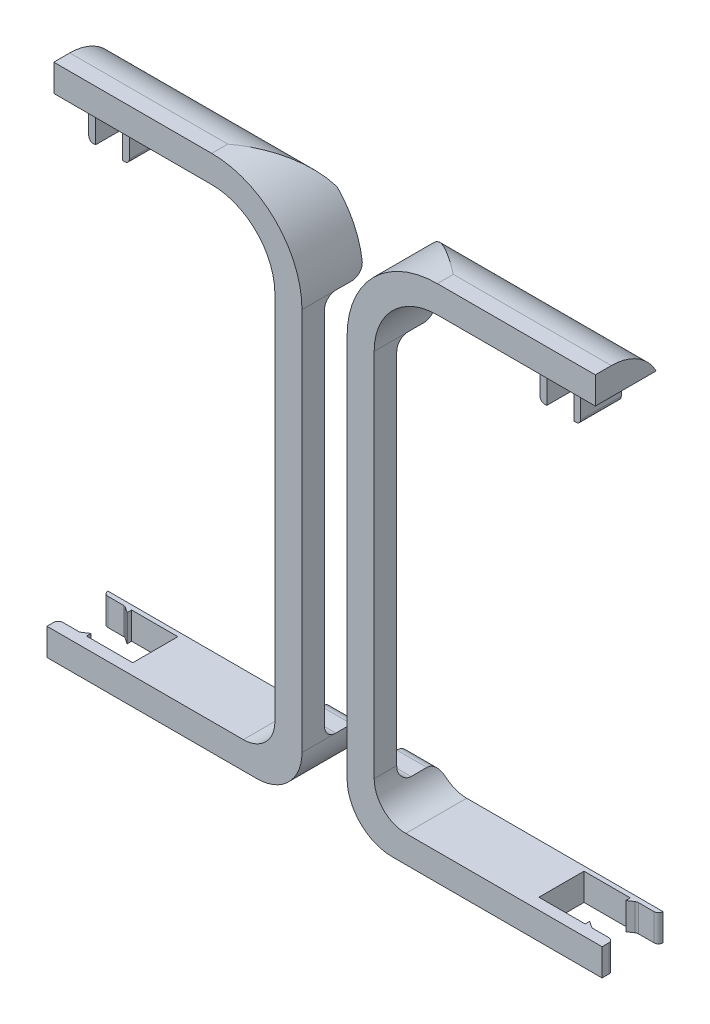
from build123d import *

# Parameters (mm, degrees)
EXTRUDE_1_DEPTH          = 12
EXTRUDE_2_DEPTH          = 27
SKETCH_6_W               = 3
SKETCH_6_H               = 18
EXTRUDE_3_DEPTH          = 15
EXTRUDE_4_DEPTH          = 27
CUT_EXTRUDE_4_DEPTH      = 258.678093753
CUT_EXTRUDE_5_DEPTH      = 257.376676006
FILLET_1_R               = 2
CUT_EXTRUDE_6_DEPTH      = 258.678093852
CUT_EXTRUDE_6_DEPTH_BACK = 258.678093852
SKETCH_10_W              = 17
SKETCH_10_H              = 170
FILLET_3_R               = 5
FILLET_4_R               = 2
SKETCH_11_W              = 17.589791481
SKETCH_11_H              = 30.84175393
EXTRUDE_5_DEPTH          = 10
CUT_EXTRUDE_7_REACH      = 268.268
SKETCH_12_W              = 20
SKETCH_12_H              = 30.84175393


with BuildPart() as part:
    # 草图1 → 凸台-拉伸1 (new body)
    with BuildSketch(Plane(origin=(0, 0, 0), x_dir=(1, 0, 0), z_dir=(0, 1, 0))):
        Polygon((-113, 5), (-113, 0), (0, 0), (0, 27), (-113, 27), (-113, 25), (-103.5, 25), (-100.5, 23), (-100.5, 25), (-80, 25), (-80, 5), (-100.5, 5), (-100.5, 7), (-103.5, 5), align=None)
    extrude(amount=EXTRUDE_1_DEPTH)

    # 草图5 → 凸台-拉伸2 (add)
    with BuildSketch(Plane(origin=(0, 0, -27), x_dir=(-1, 0, 0), z_dir=(0, 0, -1))):
        with BuildLine():
            Line((0, 0), (12, 0))
            Line((12, 0), (12, 190))
            ThreePointArc((12, 190), (20.201010127, 209.798989873), (40, 218))
            Line((40, 218), (110, 218))
            Line((110, 218), (110, 230))
            Line((110, 230), (40, 230))
            ThreePointArc((40, 230), (11.715728753, 218.284271247), (0, 190))
            Line((0, 190), (0, 0))
        make_face()
    extrude(amount=-EXTRUDE_2_DEPTH)

    # 草图6 → 凸台-拉伸3 (add)
    with BuildSketch(Plane.XZ.offset(-218)):
        with Locations((-97.5, -13.5)):
            Rectangle(SKETCH_6_W, SKETCH_6_H)
        with Locations((-82.5, -13.5)):
            Rectangle(SKETCH_6_W, SKETCH_6_H)
    extrude(amount=EXTRUDE_3_DEPTH)

    # 草图7 → 凸台-拉伸4 (add)
    with BuildSketch(Plane(origin=(0, 0, -27), x_dir=(-1, 0, 0), z_dir=(0, 0, -1))):
        with BuildLine():
            Line((26, 12), (12, 12))
            Line((12, 12), (12, 26))
            ThreePointArc((12, 26), (16.100505063, 16.100505063), (26, 12))
        make_face()
    extrude(amount=-EXTRUDE_4_DEPTH)

    # 草图8 → 切除-拉伸4 (cut, through all)
    with BuildSketch(Plane(origin=(0, 0, -27), x_dir=(-1, 0, 0), z_dir=(0, 0, -1))):
        with BuildLine():
            Line((0, 20), (0, 0))
            Line((0, 0), (20, 0))
            ThreePointArc((20, 0), (5.857864376, 5.857864376), (0, 20))
        make_face()
    extrude(amount=-CUT_EXTRUDE_4_DEPTH, mode=Mode.SUBTRACT)

    # 草图9 → 切除-拉伸5 (cut, through all)
    with BuildSketch(Plane.ZY.offset(110)):
        with BuildLine():
            Line((-27, 230), (-27, 218))
            ThreePointArc((-27, 218), (-18.719201296, 226.767848868), (-7.100251258, 230))
            Line((-7.100251258, 230), (-27, 230))
        make_face()
    extrude(amount=-CUT_EXTRUDE_5_DEPTH, mode=Mode.SUBTRACT)

    # 圆角1
    fillet_1_edges = [part.edges().sort_by_distance(p)[0] for p in [
        (-99, 203, -13.5),
        (-81, 203, -13.5),
    ]]
    fillet(fillet_1_edges, radius=FILLET_1_R)

    # 草图10 → 切除-拉伸6 (cut, two sides: drawn at the far end of the back side and taken through both)
    with BuildSketch(Plane(origin=(0, 0, 0), x_dir=(0, 0, -1), z_dir=(1, 0, 0)).offset(-CUT_EXTRUDE_6_DEPTH_BACK)):
        with Locations((18.5, 105)):
            Rectangle(SKETCH_10_W, SKETCH_10_H)
    extrude(amount=CUT_EXTRUDE_6_DEPTH + CUT_EXTRUDE_6_DEPTH_BACK, mode=Mode.SUBTRACT)

    # 圆角3
    fillet_3_edges = [part.edges().sort_by_distance(p)[0] for p in [
        (-6.67544468, 20, -27),
        (-6, 190, -27),
        (-6.67544468, 20, -10),
        (-6, 190, -10),
    ]]
    fillet(fillet_3_edges, radius=FILLET_3_R)

    # 圆角4
    fillet_4_edges = [part.edges().sort_by_distance(p)[0] for p in [
        (-113, 6, -5),
        (-103.5, 6, -5),
        (-103.5, 6, -25),
        (-113, 6, -25),
    ]]
    fillet(fillet_4_edges, radius=FILLET_4_R - 0.0001)  # a hair under: the kernel refuses the full size

    # 草图11 → 凸台-拉伸5 (add)
    with BuildSketch(Plane(origin=(10, 0, 0), x_dir=(0, 0, -1), z_dir=(1, 0, 0))):
        with Locations((8.794895741, 105.194403444)):
            Rectangle(SKETCH_11_W, SKETCH_11_H)
    extrude(amount=-EXTRUDE_5_DEPTH)

    # 镜向8: part across plane


with BuildPart() as part_1:
    add(part.part)
    add(part.part.mirror(Plane(origin=(10, 0, 0), x_dir=(0, 0, 1), z_dir=(1, 0, 0))))

    # 草图12 → 切除-拉伸7 (cut, up to next)
    with BuildSketch(Plane(origin=(0, 0, -17.589791481), x_dir=(-1, 0, 0), z_dir=(0, 0, -1)), mode=Mode.PRIVATE) as cut_extrude_7_sk1:
        with Locations((-10, 105.194403444)):
            Rectangle(SKETCH_12_W, SKETCH_12_H)
    cut_extrude_7_tool1 = extrude(cut_extrude_7_sk1.sketch, amount=-CUT_EXTRUDE_7_REACH, mode=Mode.PRIVATE) & part_1.part
    add(cut_extrude_7_tool1.solids().sort_by_distance((10, 105.194403, -17.589791))[0], mode=Mode.SUBTRACT)


with BuildPart() as cut_extrude_7_piece_1:
    # of the separate pieces the step leaves, piece 1, a body of its own (cut_extrude_7_pieces)
    add(part_1.part.solids().sort_by_distance((-102.996176075, 12, -5.335882616))[0])


with BuildPart() as cut_extrude_7_piece_2:
    # of the separate pieces the step leaves, piece 2, a body of its own (cut_extrude_7_pieces)
    add(part_1.part.solids().sort_by_distance((20, 20, 0))[0])


solid = Compound([cut_extrude_7_piece_1.part, cut_extrude_7_piece_2.part])
